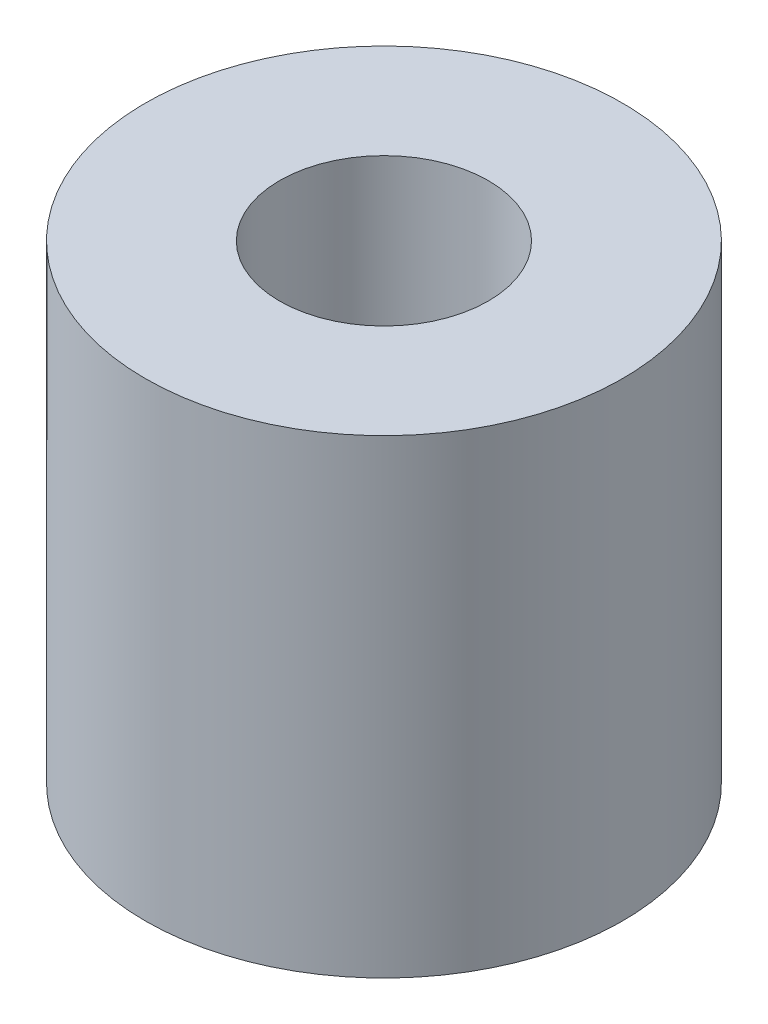
from build123d import *

# Parameters (mm, degrees)
SKETCH1_R           = 4.572
SKETCH1_R_2         = 2
BOSS_EXTRUDE1_DEPTH = 9


with BuildPart() as part:
    # Sketch1 → Boss-Extrude1 (new body)
    with BuildSketch(Plane(origin=(0, 0, 0), x_dir=(1, 0, 0), z_dir=(0, 1, 0))):
        Circle(SKETCH1_R)
        Circle(SKETCH1_R_2, mode=Mode.SUBTRACT)
    extrude(amount=BOSS_EXTRUDE1_DEPTH)


solid = part.part
